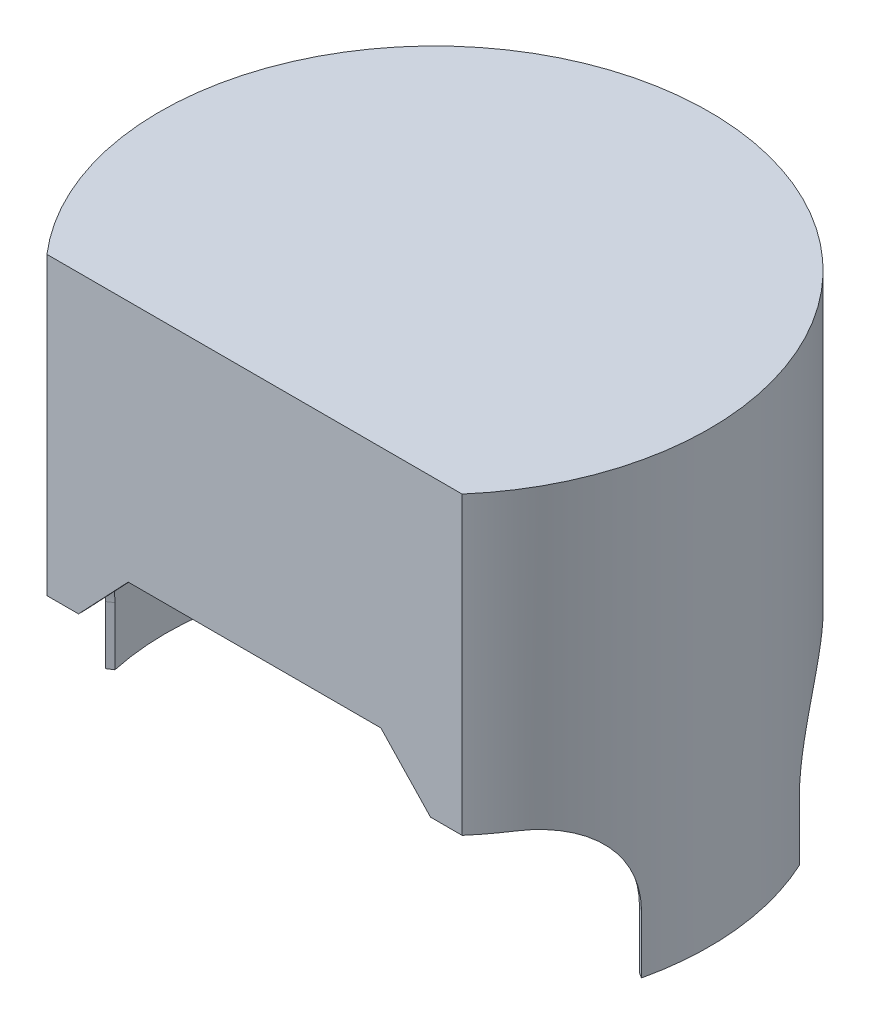
from build123d import *
from build123d.topology import SkipClean

# Parameters (mm, degrees)
BOSS_EXTRUDE1_DEPTH       = 140
BOSS_EXTRUDE2_DEPTH       = 2
CUT_EXTRUDE1_REACH        = 189.888
CUT_EXTRUDE1_END_RADIUS   = 87
CIRPATTERN1_COUNT         = 2
CIRPATTERN1_ANGLE         = 78
MIRROR1_COPY_1_REACH      = 189.888
MIRROR1_COPY_1_END_RADIUS = 87
CUT_EXTRUDE3_START        = -72.96499449
CUT_EXTRUDE3_OUTLINE_W    = 9.617412702
CUT_EXTRUDE3_OUTLINE_H    = 48.400041505
CUT_EXTRUDE3_DEPTH        = 145.92998898
CUT_EXTRUDE2_START        = -2
CUT_EXTRUDE2_DEPTH        = 2


# Read off the part's stored shape, not the designer's step: Cut-Extrude3, Cut-Extrude2
with BuildPart() as part:
    # Sketch1 → Boss-Extrude1 (new body)
    with BuildSketch(Plane(origin=(0, 0, 0), x_dir=(1, 0, 0), z_dir=(0, 1, 0))):
        with BuildLine():
            Line((65.726706901, -57), (-65.726706901, -57))
            ThreePointArc((-65.726706901, -57), (0, 87), (65.726706901, -57))
        make_face()
        with BuildLine():
            Line((-64.807406984, -55), (64.807406984, -55))
            ThreePointArc((64.807406984, -55), (0, 85), (-64.807406984, -55))
        make_face(mode=Mode.SUBTRACT)
    extrude(amount=BOSS_EXTRUDE1_DEPTH)

    # Sketch2 → Boss-Extrude2 (add)
    with SkipClean():  # the faces are left unmerged after this step: merging them gives an invalid solid
        with BuildSketch(Plane(origin=(0, 140, 0), x_dir=(1, 0, 0), z_dir=(0, 1, 0))):
            with BuildLine():
                Line((-65.726706901, -57), (65.726706901, -57))
                ThreePointArc((65.726706901, -57), (0, 87), (-65.726706901, -57))
            make_face()
        extrude(amount=BOSS_EXTRUDE2_DEPTH)

    # Cut-Extrude1: up to this cylinder (the profile starts inside it)
    with SkipClean():  # the faces are left unmerged after this step: merging them gives an invalid solid
        cut_extrude1_end = Plane(origin=(0, 9.2, 0), z_dir=(0, -1, 0)) * Cylinder(CUT_EXTRUDE1_END_RADIUS, 554.776, mode=Mode.PRIVATE)
        # Sketch3 → Cut-Extrude1 (cut, up to the surface)
        with BuildSketch(Plane(origin=(0, 0, 0), x_dir=(0.7071067811865464, 0, -0.7071067811865488), z_dir=(0.7071067811865488, 0, 0.7071067811865464)), mode=Mode.PRIVATE) as cut_extrude1_sk1:
            with BuildLine():
                Line((-30, 0), (-30, 18.4))
                ThreePointArc((-30, 18.4), (0, 48.4), (30, 18.4))
                Line((30, 18.4), (30, 0))
                ThreePointArc((30, 0), (0, -30), (-30, 0))
            make_face()
        cut_extrude1_tool1 = extrude(cut_extrude1_sk1.sketch, amount=-CUT_EXTRUDE1_REACH, mode=Mode.PRIVATE) & cut_extrude1_end
        cut_extrude1 = cut_extrude1_tool1.solids().sort_by_distance((0, 9.2, 0))[0]
        add(cut_extrude1, mode=Mode.SUBTRACT)

    # CirPattern1: Cut-Extrude1 ×2 about axis
    with SkipClean():  # the faces are left unmerged after this step: merging them gives an invalid solid
        cirpattern1_axis = Axis((0, 140, 0), (0, 1, 0))
        for i in range(1, CIRPATTERN1_COUNT):
            add(cut_extrude1.rotate(cirpattern1_axis, i * CIRPATTERN1_ANGLE / (CIRPATTERN1_COUNT - 1)), mode=Mode.SUBTRACT)

    # Mirror1: Cut-Extrude1 across plane
    with SkipClean():  # the faces are left unmerged after this step: merging them gives an invalid solid
        add(cut_extrude1.mirror(Plane(origin=(0, 0, 0), x_dir=(0, 0, 1), z_dir=(1, 0, 0))), mode=Mode.SUBTRACT)

    # Mirror1 copy 1: up to this cylinder (the profile starts inside it)
    with SkipClean():  # the faces are left unmerged after this step: merging them gives an invalid solid
        mirror1_copy_1_end = Plane(origin=(0, 9.2, 0), z_dir=(0, -1, 0)) * Cylinder(MIRROR1_COPY_1_END_RADIUS, 554.776, mode=Mode.PRIVATE)
        # Mirror1 copy 1 sketch → Mirror1 copy 1 (cut, up to the surface)
        with BuildSketch(Plane(origin=(0, 0, 0), x_dir=(0.544639035015031, 0, -0.8386705679454215), z_dir=(-0.8386705679454215, 0, -0.544639035015031)), mode=Mode.PRIVATE) as mirror1_copy_1_sk1:
            with BuildLine():
                Line((-30, 0), (-30, -18.4))
                ThreePointArc((-30, -18.4), (0, -48.4), (30, -18.4))
                Line((30, -18.4), (30, 0))
                ThreePointArc((30, 0), (0, 30), (-30, 0))
            make_face()
        mirror1_copy_1_tool1 = extrude(mirror1_copy_1_sk1.sketch, amount=-MIRROR1_COPY_1_REACH, mode=Mode.PRIVATE) & mirror1_copy_1_end
        add(mirror1_copy_1_tool1.solids().sort_by_distance((0, 9.2, 0))[0], mode=Mode.SUBTRACT)

    # Cut-Extrude3 outline → Cut-Extrude3 (cut)
    with SkipClean():  # the faces are left unmerged after this step: merging them gives an invalid solid
        with BuildSketch(Plane(origin=(0, 0, 0), x_dir=(0, 0, -1), z_dir=(1, 0, 0)).offset(CUT_EXTRUDE3_START)):
            with Locations((-52.191293649, 24.200020753)):
                Rectangle(CUT_EXTRUDE3_OUTLINE_W, CUT_EXTRUDE3_OUTLINE_H)
        extrude(amount=CUT_EXTRUDE3_DEPTH, mode=Mode.SUBTRACT)

    # Cut-Extrude2 outline → Cut-Extrude2 (cut)
    with SkipClean():  # the faces are left unmerged after this step: merging them gives an invalid solid
        with BuildSketch(Plane.XY.offset(57).offset(CUT_EXTRUDE2_START)):
            Polygon((-55.726706901, 48.400041505), (55.726706901, 48.400041505), (40, 65), (-40, 65), align=None)
        extrude(amount=CUT_EXTRUDE2_DEPTH, mode=Mode.SUBTRACT)


solid = part.part
